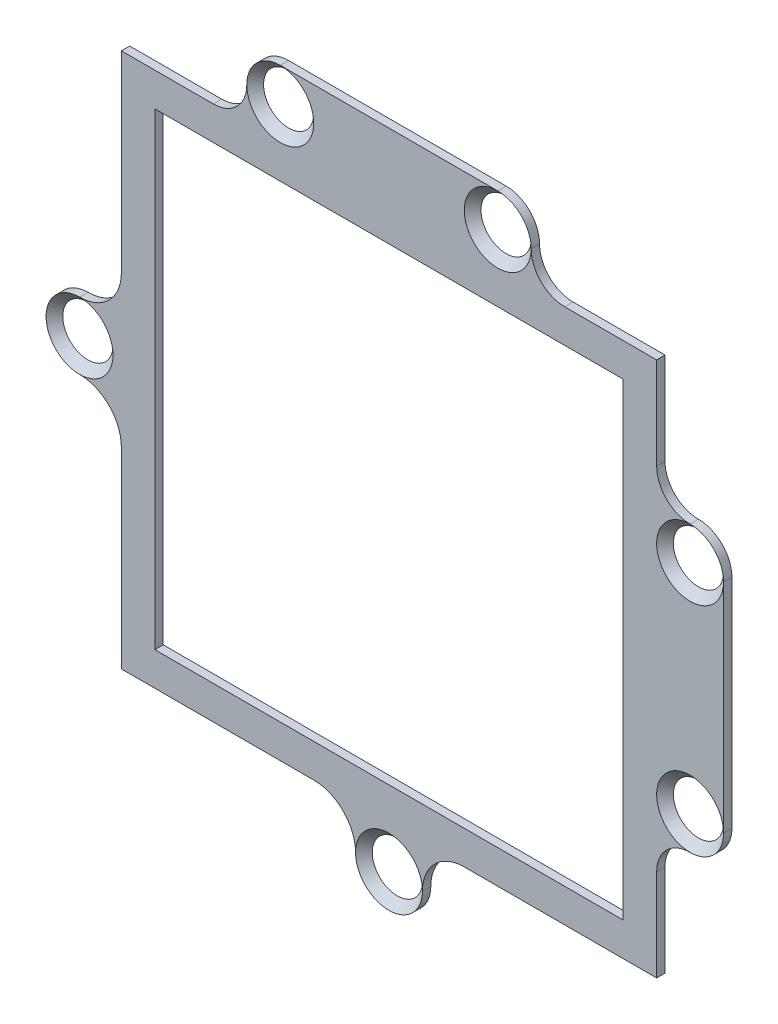
from build123d import *

# Parameters (mm, degrees)
SKETCH1_R           = 2
SKETCH1_W           = 56
SKETCH1_H           = 56
BOSS_EXTRUDE1_DEPTH = 1
CHAMFER1_SIZE       = 2


with BuildPart() as part:
    # Sketch1 → Boss-Extrude1 (new body)
    with BuildSketch(Plane.XY):
        with BuildLine():
            Line((40, -13), (40, 13))
            ThreePointArc((40, 13), (38.828427125, 15.828427125), (36, 17))
            ThreePointArc((36, 17), (33.171572875, 18.171572875), (32, 21))
            Line((32, 21), (32, 32))
            Line((32, 32), (21, 32))
            ThreePointArc((21, 32), (18.171572875, 33.171572875), (17, 36))
            ThreePointArc((17, 36), (15.828427125, 38.828427125), (13, 40))
            Line((13, 40), (-13, 40))
            ThreePointArc((-13, 40), (-15.828427125, 38.828427125), (-17, 36))
            ThreePointArc((-17, 36), (-18.171572875, 33.171572875), (-21, 32))
            Line((-21, 32), (-32, 32))
            Line((-32, 32), (-32, 9))
            ThreePointArc((-32, 9), (-33.464466094, 5.464466094), (-37, 4))
            ThreePointArc((-37, 4), (-41, 0), (-37, -4))
            ThreePointArc((-37, -4), (-33.464466094, -5.464466094), (-32, -9))
            Line((-32, -9), (-32, -32))
            Line((-32, -32), (-9, -32))
            ThreePointArc((-9, -32), (-5.464466094, -33.464466094), (-4, -37))
            ThreePointArc((-4, -37), (0, -41), (4, -37))
            ThreePointArc((4, -37), (5.464466094, -33.464466094), (9, -32))
            Line((9, -32), (32, -32))
            Line((32, -32), (32, -21))
            ThreePointArc((32, -21), (33.171572875, -18.171572875), (36, -17))
            ThreePointArc((36, -17), (38.828427125, -15.828427125), (40, -13))
        make_face()
        with Locations((-37, 0)):
            Circle(SKETCH1_R, mode=Mode.SUBTRACT)
        with Locations((-13, 36)):
            Circle(SKETCH1_R, mode=Mode.SUBTRACT)
        with Locations((0, -37)):
            Circle(SKETCH1_R, mode=Mode.SUBTRACT)
        with Locations((36, -13)):
            Circle(SKETCH1_R, mode=Mode.SUBTRACT)
        with Locations((36, 13)):
            Circle(SKETCH1_R, mode=Mode.SUBTRACT)
        with Locations((13, 36)):
            Circle(SKETCH1_R, mode=Mode.SUBTRACT)
        Rectangle(SKETCH1_W, SKETCH1_H, mode=Mode.SUBTRACT)
    extrude(amount=BOSS_EXTRUDE1_DEPTH)

    # Chamfer1
    # the kernel refuses this chamfer: 2 mm, written as the material it takes off along each edge
    with BuildSketch(Plane(origin=(13, 36, 1), x_dir=(1, 0, 0), z_dir=(0, -1, 0))) as chamfer1_piece_1:
        Polygon((2, -CHAMFER1_SIZE), (2 + CHAMFER1_SIZE, 0), (2, 0), align=None)
    revolve(axis=Axis((13, 36, 1), (0, 0, 1)), mode=Mode.SUBTRACT)
    with BuildSketch(Plane(origin=(-13, 36, 1), x_dir=(1, 0, 0), z_dir=(0, -1, 0))) as chamfer1_piece_2:
        Polygon((2, -CHAMFER1_SIZE), (2 + CHAMFER1_SIZE, 0), (2, 0), align=None)
    revolve(axis=Axis((-13, 36, 1), (0, 0, 1)), mode=Mode.SUBTRACT)
    with BuildSketch(Plane(origin=(-37, 0, 1), x_dir=(1, 0, 0), z_dir=(0, -1, 0))) as chamfer1_piece_3:
        Polygon((2, -CHAMFER1_SIZE), (2 + CHAMFER1_SIZE, 0), (2, 0), align=None)
    revolve(axis=Axis((-37, 0, 1), (0, 0, 1)), mode=Mode.SUBTRACT)
    with BuildSketch(Plane(origin=(36, -13, 1), x_dir=(1, 0, 0), z_dir=(0, -1, 0))) as chamfer1_piece_4:
        Polygon((2, -CHAMFER1_SIZE), (2 + CHAMFER1_SIZE, 0), (2, 0), align=None)
    revolve(axis=Axis((36, -13, 1), (0, 0, 1)), mode=Mode.SUBTRACT)
    with BuildSketch(Plane(origin=(0, -37, 1), x_dir=(1, 0, 0), z_dir=(0, -1, 0))) as chamfer1_piece_5:
        Polygon((2, -CHAMFER1_SIZE), (2 + CHAMFER1_SIZE, 0), (2, 0), align=None)
    revolve(axis=Axis((0, -37, 1), (0, 0, 1)), mode=Mode.SUBTRACT)
    with BuildSketch(Plane(origin=(36, 13, 1), x_dir=(1, 0, 0), z_dir=(0, -1, 0))) as chamfer1_piece_6:
        Polygon((2, -CHAMFER1_SIZE), (2 + CHAMFER1_SIZE, 0), (2, 0), align=None)
    revolve(axis=Axis((36, 13, 1), (0, 0, 1)), mode=Mode.SUBTRACT)


solid = part.part
